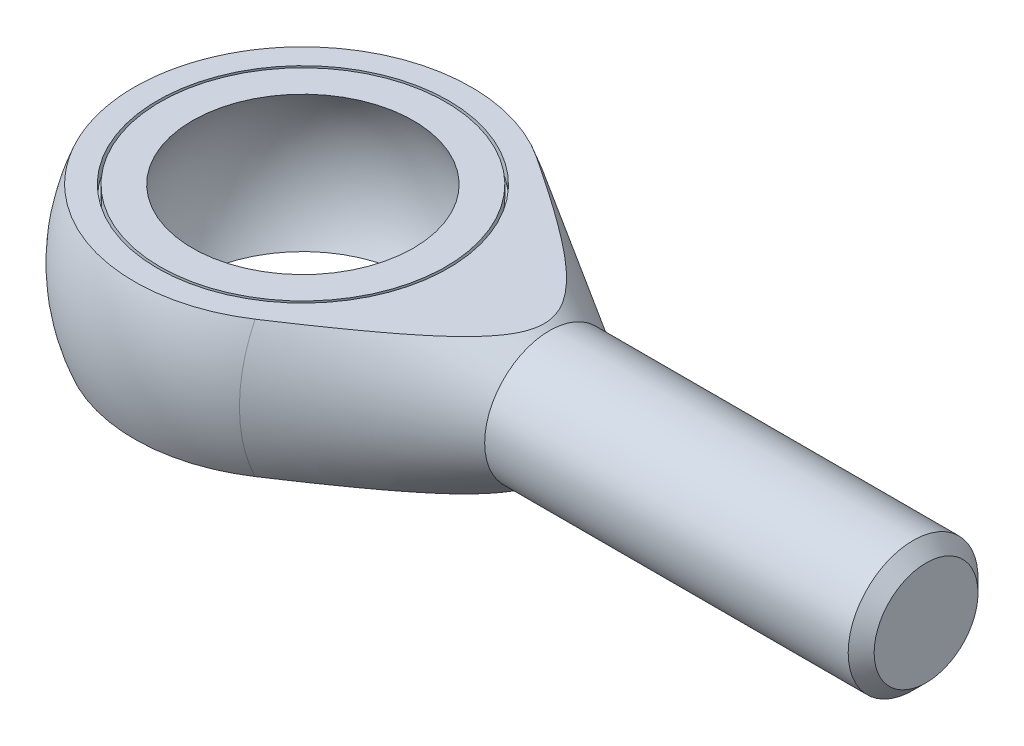
from build123d import *

# Parameters (mm, degrees)
CUT_EXTRUDE1_DEPTH      = 28.440845468
CUT_EXTRUDE1_DEPTH_BACK = 28.440845468
SKETCH3_W               = 33
SKETCH3_H               = 8.75
SKETCH4_W               = 0.2
SKETCH4_H               = 1
SKETCH5_R               = 5
BOSS_EXTRUDE1_DEPTH     = 29
CHAMFER1_SIZE           = 1


with BuildPart() as part:
    # Sketch2 → Revolve2 (revolve)
    with BuildSketch(Plane(origin=(0, 0, 0), x_dir=(1, 0, 0), z_dir=(0, 1, 0))):
        with BuildLine():
            Line((7.147970434, 12.037712352), (19, 5))
            Line((19, 5), (19, 0))
            Line((19, 0), (-14, 0))
            ThreePointArc((-14, 0), (-6.925619609, 12.166996056), (7.147970434, 12.037712352))
        make_face()
    revolve(axis=Axis((-39.456415939, 0, 0), (1, 0, 0)))

    # Sketch3 → Cut-Extrude1 (cut, two sides: drawn at the far end of the back side and taken through both)
    with BuildSketch(Plane.XY.offset(-CUT_EXTRUDE1_DEPTH_BACK)):
        with Locations((2.5, 9.625)):
            Rectangle(SKETCH3_W, SKETCH3_H)
        with Locations((2.5, -9.625)):
            Rectangle(SKETCH3_W, SKETCH3_H)
    extrude(amount=CUT_EXTRUDE1_DEPTH + CUT_EXTRUDE1_DEPTH_BACK, mode=Mode.SUBTRACT)

    # Sketch4 → Cut-Revolve1 (revolve, cut)
    with BuildSketch(Plane.XY):
        with BuildLine():
            Line((0, 10), (0, -10))
            ThreePointArc((0, -10), (10, 0), (0, 10))
        make_face()
        with Locations((11.1, 4.75)):
            Rectangle(SKETCH4_W, SKETCH4_H)
        with Locations((11.1, -4.75)):
            Rectangle(SKETCH4_W, SKETCH4_H)
    revolve(axis=Axis((0, 13.975998128, 0), (0, -1, 0)), mode=Mode.SUBTRACT)

    # Sketch5 → Boss-Extrude1 (add)
    with BuildSketch(Plane(origin=(19, 0, 0), x_dir=(0, 0, -1), z_dir=(1, 0, 0))):
        Circle(SKETCH5_R)
    extrude(amount=BOSS_EXTRUDE1_DEPTH)

    # Chamfer1
    chamfer1_edges = [part.edges().sort_by_distance(p)[0] for p in [
        (48, 0, 5),
    ]]
    chamfer(chamfer1_edges, length=CHAMFER1_SIZE)


solid = part.part
